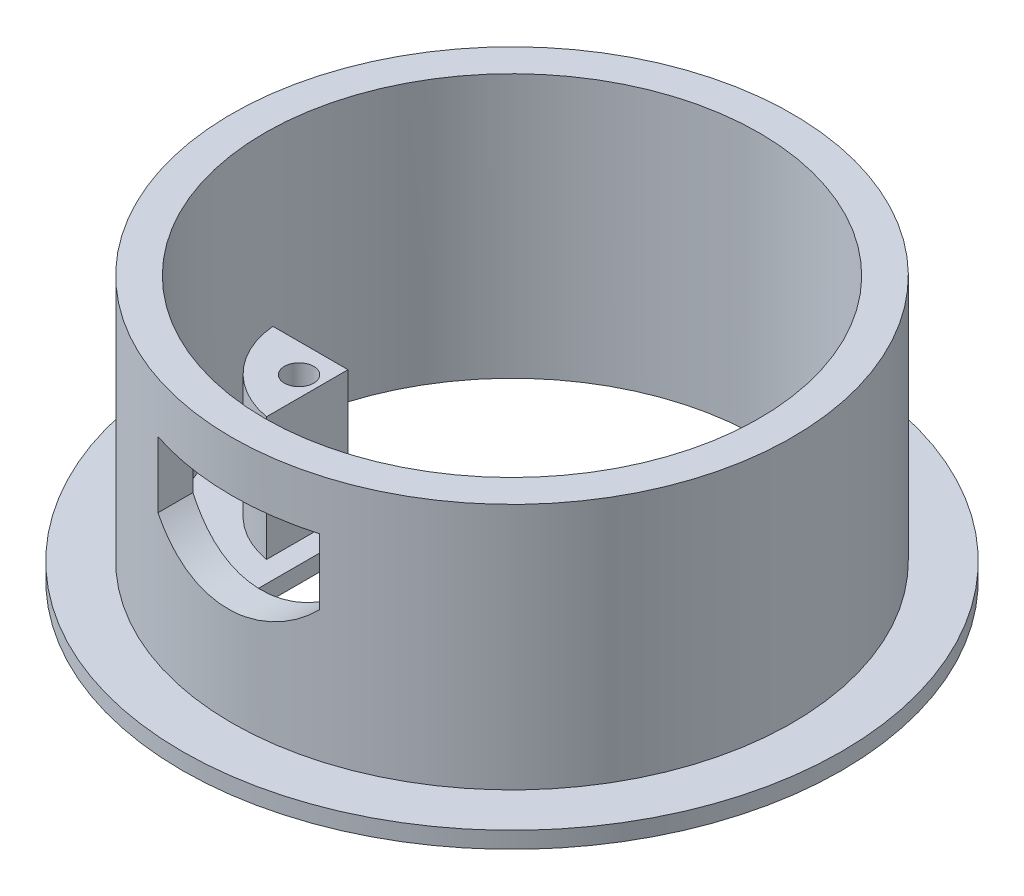
from build123d import *

# Parameters (mm, degrees)
SKETCH1_R           = 40
SKETCH1_R_2         = 30
BOSS_EXTRUDE1_DEPTH = 2
SKETCH2_R           = 34
SKETCH2_R_2         = 30
BOSS_EXTRUDE2_DEPTH = 30
BOSS_EXTRUDE3_DEPTH = 2
CUT_EXTRUDE1_DEPTH  = 7
BOSS_EXTRUDE4_DEPTH = 15
SKETCH12_R          = 1.775
CUT_EXTRUDE2_DEPTH  = 9
CUT_EXTRUDE3_DEPTH  = 10


with BuildPart() as part:
    # Sketch1 → Boss-Extrude1 (new body)
    with BuildSketch(Plane(origin=(0, 0, 0), x_dir=(1, 0, 0), z_dir=(0, 1, 0))):
        Circle(SKETCH1_R)
        Circle(SKETCH1_R_2, mode=Mode.SUBTRACT)
    extrude(amount=BOSS_EXTRUDE1_DEPTH)

    # Sketch2 → Boss-Extrude2 (add)
    with BuildSketch(Plane(origin=(0, 2, 0), x_dir=(1, 0, 0), z_dir=(0, 1, 0))):
        Circle(SKETCH2_R)
        Circle(SKETCH2_R_2, mode=Mode.SUBTRACT)
    extrude(amount=BOSS_EXTRUDE2_DEPTH)

    # Sketch9 → Boss-Extrude3 (add)
    with BuildSketch(Plane(origin=(0, 0, 0), x_dir=(1, 0, 0), z_dir=(0, 1, 0))):
        with BuildLine():
            Line((-29.865737826, -2.835084495), (29.865737826, -2.835084495))
            ThreePointArc((29.865737826, -2.835084495), (20.185978613, -22.192932826), (0, -30))
            ThreePointArc((0, -30), (-20.185978613, -22.192932826), (-29.865737826, -2.835084495))
        make_face()
    extrude(amount=BOSS_EXTRUDE3_DEPTH)

    # Sketch10 → Cut-Extrude1 (cut)
    with BuildSketch(Plane.XY.offset(35)):
        with BuildLine():
            Line((-10.668263465, 25.889544809), (9.331736535, 25.889544809))
            Line((9.331736535, 25.889544809), (9.331736535, 17.889544809))
            ThreePointArc((9.331736535, 17.889544809), (-0.668263465, 13.747409185), (-10.668263465, 17.889544809))
            Line((-10.668263465, 17.889544809), (-10.668263465, 25.889544809))
        make_face()
    extrude(amount=-CUT_EXTRUDE1_DEPTH, mode=Mode.SUBTRACT)

    # Sketch11 → Boss-Extrude4 (add)
    with BuildSketch(Plane(origin=(0, 2, 0), x_dir=(1, 0, 0), z_dir=(0, 1, 0))):
        with BuildLine():
            Line((-24.173456416, -4.835084495), (-15.0625297, -4.835084495))
            Line((-15.0625297, -4.835084495), (-15.0625297, -14.717703762))
            ThreePointArc((-15.0625297, -14.717703762), (-21.294330348, -11.321833226), (-24.173456416, -4.835084495))
        make_face()
        with BuildLine():
            Line((24.173456416, -4.835084495), (15.0625297, -4.835084495))
            Line((15.0625297, -4.835084495), (15.0625297, -14.717703762))
            ThreePointArc((15.0625297, -14.717703762), (21.294330348, -11.321833226), (24.173456416, -4.835084495))
        make_face()
    extrude(amount=BOSS_EXTRUDE4_DEPTH)

    # Sketch12 → Cut-Extrude2 (cut)
    with BuildSketch(Plane(origin=(0, 17, 0), x_dir=(1, 0, 0), z_dir=(0, 1, 0))):
        with Locations((-17.5, -8.335084495)):
            Circle(SKETCH12_R)
        with Locations((17.5, -8.335084495)):
            Circle(SKETCH12_R)
    extrude(amount=-CUT_EXTRUDE2_DEPTH, mode=Mode.SUBTRACT)

    # Sketch13 → Cut-Extrude3 (cut)
    with BuildSketch(Plane(origin=(0, 2, 0), x_dir=(1, 0, 0), z_dir=(0, 1, 0))):
        with BuildLine():
            Line((-12.520903972, -20.798444431), (-12.520903972, 1.201555569))
            Line((-12.520903972, 1.201555569), (13.479096028, 1.201555569))
            Line((13.479096028, 1.201555569), (13.479096028, -20.798444431))
            ThreePointArc((13.479096028, -20.798444431), (0.479096028, -26.183220742), (-12.520903972, -20.798444431))
        make_face()
    extrude(amount=-CUT_EXTRUDE3_DEPTH, mode=Mode.SUBTRACT)


solid = part.part
